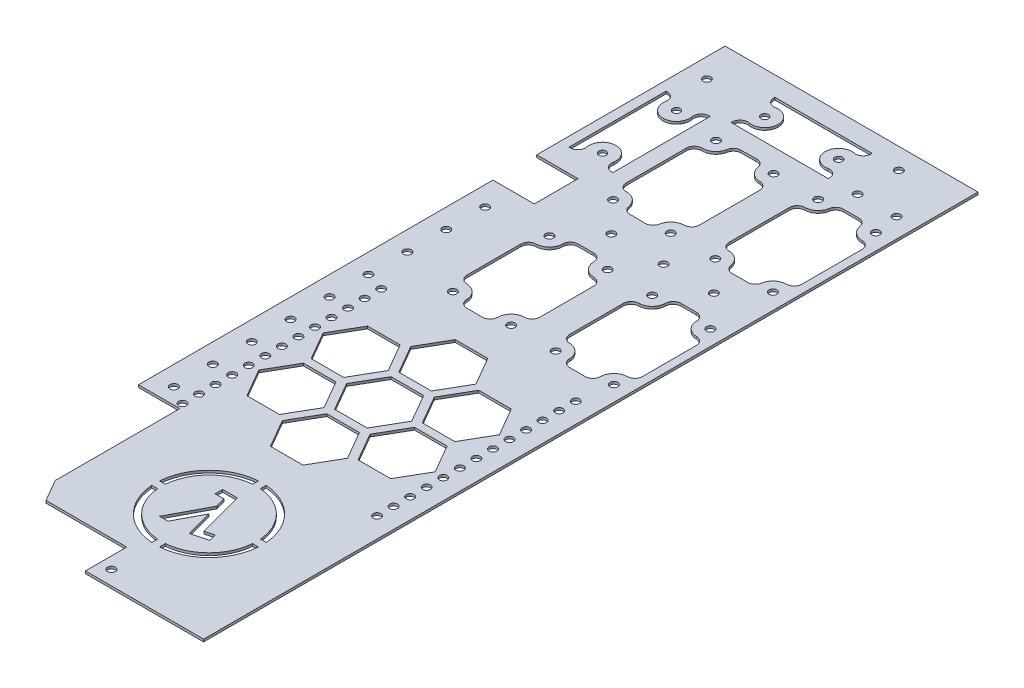
from build123d import *

# Parameters (mm, degrees)
SKETCH1_R           = 2.54
SKETCH1_R_2         = 2.413
BOSS_EXTRUDE1_DEPTH = 1.5875
SKETCH5_R           = 2.54
CUT_EXTRUDE1_DEPTH  = 548.721601199
SKETCH6_W           = 26.9875
SKETCH6_H           = 7.62
SKETCH6_W_2         = 10.16
SKETCH6_H_2         = 26.9875
CUT_EXTRUDE2_DEPTH  = 2.54


with BuildPart() as part:
    # Sketch1 → Boss-Extrude1 (new body)
    with BuildSketch(Plane(origin=(0, 0, 0), x_dir=(1, 0, 0), z_dir=(0, 1, 0))):
        Polygon((-347.6625, -284.566318976), (-347.6625, -358.297540145), (-339.43124039, -372.5545), (-296.8625, -372.5545), (-296.8625, -399.542), (-209.55, -399.542), (-209.55, 106.045), (-374.65, 106.045), (-374.65, -16.9545), (-347.6625, -16.9545), (-347.6625, -45.5295), (-374.65, -45.5295), (-374.65, -284.566318976), align=None)
        with Locations(Location((-349.635439689, -273.224316882, 0), (0, 0, 270))):
            Circle(SKETCH1_R, mode=Mode.SUBTRACT)
        with BuildLine():
            ThreePointArc((-281.14625, -361.805423394), (-303.301954333, -351.668613821), (-313.438763906, -329.512909488))
            Line((-313.438763906, -329.512909488), (-309.617403236, -329.512909488))
            ThreePointArc((-309.617403236, -329.512909488), (-300.607877497, -348.974536984), (-281.14625, -357.984062723))
            Line((-281.14625, -357.984062723), (-281.14625, -361.805423394))
        make_face(mode=Mode.SUBTRACT)
        with BuildLine():
            ThreePointArc((-313.438763906, -324.432909488), (-303.301954333, -302.277205155), (-281.14625, -292.140395582))
            Line((-281.14625, -292.140395582), (-281.14625, -295.961756252))
            ThreePointArc((-281.14625, -295.961756252), (-300.607877497, -304.971281991), (-309.617403236, -324.432909488))
            Line((-309.617403236, -324.432909488), (-313.438763906, -324.432909488))
        make_face(mode=Mode.SUBTRACT)
        with Locations(Location((-349.635439689, -262.414650564, 0), (0, 0, 270))):
            Circle(SKETCH1_R, mode=Mode.SUBTRACT)
        with Locations(Location((-349.635439689, -251.604984246, 0), (0, 0, 270))):
            Circle(SKETCH1_R, mode=Mode.SUBTRACT)
        with Locations(Location((-349.635439689, -240.795317929, 0), (0, 0, 270))):
            Circle(SKETCH1_R, mode=Mode.SUBTRACT)
        with Locations(Location((-349.635439689, -229.985651611, 0), (0, 0, 270))):
            Circle(SKETCH1_R, mode=Mode.SUBTRACT)
        with Locations(Location((-349.635439689, -219.175985293, 0), (0, 0, 270))):
            Circle(SKETCH1_R, mode=Mode.SUBTRACT)
        with Locations(Location((-349.635439689, -208.366318976, 0), (0, 0, 270))):
            Circle(SKETCH1_R, mode=Mode.SUBTRACT)
        with Locations(Location((-349.635439689, -197.556652658, 0), (0, 0, 270))):
            Circle(SKETCH1_R, mode=Mode.SUBTRACT)
        with Locations(Location((-349.635439689, -186.74698634, 0), (0, 0, 270))):
            Circle(SKETCH1_R, mode=Mode.SUBTRACT)
        with Locations(Location((-349.635439689, -175.937320022, 0), (0, 0, 270))):
            Circle(SKETCH1_R, mode=Mode.SUBTRACT)
        with Locations(Location((-349.635439689, -165.127653705, 0), (0, 0, 270))):
            Circle(SKETCH1_R, mode=Mode.SUBTRACT)
        with Locations(Location((-349.635439689, -154.317987387, 0), (0, 0, 270))):
            Circle(SKETCH1_R, mode=Mode.SUBTRACT)
        Polygon((-311.794219465, -210.906318976), (-301.162314258, -229.321318976), (-311.794219465, -247.736318976), (-333.05802988, -247.736318976), (-343.689935087, -229.321318976), (-333.05802988, -210.906318976), align=None, mode=Mode.SUBTRACT)
        Polygon((-311.794219465, -168.996318976), (-301.162314258, -187.411318976), (-311.794219465, -205.826318976), (-333.05802988, -205.826318976), (-343.689935087, -187.411318976), (-333.05802988, -168.996318976), align=None, mode=Mode.SUBTRACT)
        with BuildLine():
            ThreePointArc((-276.06625, -357.984062723), (-256.604622503, -348.974536984), (-247.595096764, -329.512909488))
            Line((-247.595096764, -329.512909488), (-243.773736094, -329.512909488))
            ThreePointArc((-243.773736094, -329.512909488), (-253.910545667, -351.668613821), (-276.06625, -361.805423394))
            Line((-276.06625, -361.805423394), (-276.06625, -357.984062723))
        make_face(mode=Mode.SUBTRACT)
        Polygon((-287.864467734, -344.458610625), (-293.399973917, -344.458610625), (-280.466285054, -320.031164161), (-282.197543544, -313.570019517), (-287.963258183, -313.570019517), (-287.963258183, -308.677931207), (-278.443712156, -308.677931207), (-270.461741683, -338.467050556), (-264.708186873, -336.925390192), (-263.442021248, -341.650784635), (-273.920970501, -344.458610625), (-278.60625, -326.972909488), align=None, mode=Mode.SUBTRACT)
        with BuildLine():
            Line((-276.06625, -295.961756252), (-276.06625, -292.140395582))
            ThreePointArc((-276.06625, -292.140395582), (-253.910545667, -302.277205155), (-243.773736094, -324.432909488))
            Line((-243.773736094, -324.432909488), (-247.595096764, -324.432909488))
            ThreePointArc((-247.595096764, -324.432909488), (-256.604622503, -304.971281991), (-276.06625, -295.961756252))
        make_face(mode=Mode.SUBTRACT)
        with Locations(Location((-222.626560311, -273.224316882, 0), (0, 0, 270))):
            Circle(SKETCH1_R, mode=Mode.SUBTRACT)
        Polygon((-275.499094793, -231.861318976), (-264.867189586, -250.276318976), (-275.499094793, -268.691318976), (-296.762905207, -268.691318976), (-307.394810414, -250.276318976), (-296.762905207, -231.861318976), align=None, mode=Mode.SUBTRACT)
        Polygon((-275.499094793, -189.951318976), (-264.867189586, -208.366318976), (-275.499094793, -226.781318976), (-296.762905207, -226.781318976), (-307.394810414, -208.366318976), (-296.762905207, -189.951318976), align=None, mode=Mode.SUBTRACT)
        Polygon((-275.499094793, -148.041318976), (-264.867189586, -166.456318976), (-275.499094793, -184.871318976), (-296.762905207, -184.871318976), (-307.394810414, -166.456318976), (-296.762905207, -148.041318976), align=None, mode=Mode.SUBTRACT)
        Polygon((-239.20397012, -210.906318976), (-228.572064913, -229.321318976), (-239.20397012, -247.736318976), (-260.467780535, -247.736318976), (-271.099685742, -229.321318976), (-260.467780535, -210.906318976), align=None, mode=Mode.SUBTRACT)
        with Locations(Location((-222.626560311, -262.414650564, 0), (0, 0, 270))):
            Circle(SKETCH1_R, mode=Mode.SUBTRACT)
        with Locations(Location((-222.626560311, -251.604984246, 0), (0, 0, 270))):
            Circle(SKETCH1_R, mode=Mode.SUBTRACT)
        with Locations(Location((-222.626560311, -240.795317929, 0), (0, 0, 270))):
            Circle(SKETCH1_R, mode=Mode.SUBTRACT)
        with Locations(Location((-222.626560311, -229.985651611, 0), (0, 0, 270))):
            Circle(SKETCH1_R, mode=Mode.SUBTRACT)
        with Locations(Location((-222.626560311, -219.175985293, 0), (0, 0, 270))):
            Circle(SKETCH1_R, mode=Mode.SUBTRACT)
        Polygon((-239.20397012, -168.996318976), (-228.572064913, -187.411318976), (-239.20397012, -205.826318976), (-260.467780535, -205.826318976), (-271.099685742, -187.411318976), (-260.467780535, -168.996318976), align=None, mode=Mode.SUBTRACT)
        with Locations(Location((-222.626560311, -208.366318976, 0), (0, 0, 270))):
            Circle(SKETCH1_R, mode=Mode.SUBTRACT)
        with Locations(Location((-222.626560311, -197.556652658, 0), (0, 0, 270))):
            Circle(SKETCH1_R, mode=Mode.SUBTRACT)
        with Locations(Location((-222.626560311, -186.74698634, 0), (0, 0, 270))):
            Circle(SKETCH1_R, mode=Mode.SUBTRACT)
        with Locations(Location((-222.626560311, -175.937320022, 0), (0, 0, 270))):
            Circle(SKETCH1_R, mode=Mode.SUBTRACT)
        with Locations(Location((-222.626560311, -165.127653705, 0), (0, 0, 270))):
            Circle(SKETCH1_R, mode=Mode.SUBTRACT)
        with Locations(Location((-222.626560311, -154.317987387, 0), (0, 0, 270))):
            Circle(SKETCH1_R, mode=Mode.SUBTRACT)
        with Locations(Location((-349.635439689, -143.508321069, 0), (0, 0, 270))):
            Circle(SKETCH1_R, mode=Mode.SUBTRACT)
        with Locations(Location((-324.6628, -121.666, 0), (0, 0, 270))):
            Circle(SKETCH1_R, mode=Mode.SUBTRACT)
        with BuildLine():
            Line((-329.438, -107.699325487), (-329.438, -72.640674513))
            ThreePointArc((-329.438, -72.640674513), (-327.989077576, -69.087974746), (-324.468836364, -67.561883781))
            ThreePointArc((-324.468836364, -67.561883781), (-318.365199406, -64.948737187), (-315.774269543, -58.835636364))
            ThreePointArc((-315.774269543, -58.835636364), (-314.254406454, -55.303389174), (-310.695109282, -53.848))
            Line((-310.695109282, -53.848), (-300.606690718, -53.848))
            ThreePointArc((-300.606690718, -53.848), (-297.047393546, -55.303389174), (-295.527530457, -58.835636364))
            ThreePointArc((-295.527530457, -58.835636364), (-292.925179285, -64.960179285), (-286.800636364, -67.562530457))
            ThreePointArc((-286.800636364, -67.562530457), (-283.268389174, -69.082393546), (-281.813, -72.641690718))
            Line((-281.813, -72.641690718), (-281.813, -107.698309282))
            ThreePointArc((-281.813, -107.698309282), (-283.268389174, -111.257606454), (-286.800636364, -112.777469543))
            ThreePointArc((-286.800636364, -112.777469543), (-292.925179285, -115.379820715), (-295.527530457, -121.504363636))
            ThreePointArc((-295.527530457, -121.504363636), (-297.047393546, -125.036610826), (-300.606690718, -126.492))
            Line((-300.606690718, -126.492), (-310.695109282, -126.492))
            ThreePointArc((-310.695109282, -126.492), (-314.254406454, -125.036610826), (-315.774269543, -121.504363636))
            ThreePointArc((-315.774269543, -121.504363636), (-318.365199406, -115.391262813), (-324.468836364, -112.778116219))
            ThreePointArc((-324.468836364, -112.778116219), (-327.989077576, -111.252025254), (-329.438, -107.699325487))
        make_face(mode=Mode.SUBTRACT)
        with Locations(Location((-324.6628, -58.674, 0), (0, 0, 270))):
            Circle(SKETCH1_R, mode=Mode.SUBTRACT)
        with Locations(Location((-354.094472403, 5.468735685, 0), (0, 0, 270))):
            Circle(SKETCH1_R_2, mode=Mode.SUBTRACT)
        with BuildLine():
            Line((-368.445472403, -2.151264315), (-368.445472403, 61.348735685))
            Line((-368.445472403, 61.348735685), (-367.702449806, 61.348735685))
            ThreePointArc((-367.702449806, 61.348735685), (-363.794667873, 59.514600804), (-362.708696631, 55.336625593))
            ThreePointArc((-362.708696631, 55.336625593), (-354.094472403, 44.965735685), (-345.480248176, 55.336625593))
            ThreePointArc((-345.480248176, 55.336625593), (-344.394276933, 59.514600804), (-340.486495, 61.348735685))
            Line((-340.486495, 61.348735685), (-339.743472403, 61.348735685))
            Line((-339.743472403, 61.348735685), (-339.743472403, -2.151264315))
            Line((-339.743472403, -2.151264315), (-340.486495, -2.151264315))
            ThreePointArc((-340.486495, -2.151264315), (-344.394276933, -0.317129433), (-345.480248176, 3.860845777))
            ThreePointArc((-345.480248176, 3.860845777), (-354.094472403, 14.231735685), (-362.708696631, 3.860845777))
            ThreePointArc((-362.708696631, 3.860845777), (-363.794667873, -0.317129433), (-367.702449806, -2.151264315))
            Line((-367.702449806, -2.151264315), (-368.445472403, -2.151264315))
        make_face(mode=Mode.SUBTRACT)
        with Locations(Location((-354.094472403, 53.728735685, 0), (0, 0, 270))):
            Circle(SKETCH1_R_2, mode=Mode.SUBTRACT)
        with Locations(Location((-324.268332048, -17.482469361, 0), (0, 0, 270))):
            Circle(SKETCH1_R, mode=Mode.SUBTRACT)
        with BuildLine():
            Line((-329.597773423, -3.514696489), (-329.597773423, 35.739252902))
            ThreePointArc((-329.597773423, 35.739252902), (-328.077662027, 39.363282858), (-324.427067468, 40.818443037))
            ThreePointArc((-324.427067468, 40.818443037), (-318.613536919, 42.847332482), (-315.512742635, 48.166975762))
            ThreePointArc((-315.512742635, 48.166975762), (-313.800929668, 51.156470569), (-310.575535645, 52.366518596))
            Line((-310.575535645, 52.366518596), (-300.486181661, 52.497585912))
            ThreePointArc((-300.486181661, 52.497585912), (-297.160774099, 51.314497189), (-295.408851173, 48.250382237))
            ThreePointArc((-295.408851173, 48.250382237), (-292.448569967, 42.977910171), (-286.800636364, 40.818495317))
            ThreePointArc((-286.800636364, 40.818495317), (-283.268389174, 39.298632228), (-281.813, 35.739335056))
            Line((-281.813, 35.739335056), (-281.813, -3.514778642))
            ThreePointArc((-281.813, -3.514778642), (-283.268389174, -7.074075815), (-286.800636364, -8.593938904))
            ThreePointArc((-286.800636364, -8.593938904), (-292.448569967, -10.753353758), (-295.408851173, -16.025825823))
            ThreePointArc((-295.408851173, -16.025825823), (-297.160774099, -19.089940776), (-300.486181661, -20.273029499))
            Line((-300.486181661, -20.273029499), (-310.575535645, -20.141962182))
            ThreePointArc((-310.575535645, -20.141962182), (-313.800929668, -18.931914156), (-315.512742635, -15.942419349))
            ThreePointArc((-315.512742635, -15.942419349), (-318.613536919, -10.622776069), (-324.427067468, -8.593886624))
            ThreePointArc((-324.427067468, -8.593886624), (-328.077662027, -7.138726445), (-329.597773423, -3.514696489))
        make_face(mode=Mode.SUBTRACT)
        with Locations(Location((-324.268332048, 49.707025774, 0), (0, 0, 270))):
            Circle(SKETCH1_R, mode=Mode.SUBTRACT)
        with Locations(Location((-321.818, 79.0575, 0), (0, 0, 270))):
            Circle(SKETCH1_R_2, mode=Mode.SUBTRACT)
        with BuildLine():
            Line((-329.438, 64.77), (-329.438, 65.449522597))
            ThreePointArc((-329.438, 65.449522597), (-327.603865118, 69.35730453), (-323.425889908, 70.443275772))
            ThreePointArc((-323.425889908, 70.443275772), (-313.055, 79.0575), (-323.425889908, 87.671724228))
            ThreePointArc((-323.425889908, 87.671724228), (-327.603865118, 88.75769547), (-329.438, 92.665477403))
            Line((-329.438, 92.665477403), (-329.438, 93.345))
            Line((-329.438, 93.345), (-265.938, 93.345))
            Line((-265.938, 93.345), (-265.938, 92.665477403))
            ThreePointArc((-265.938, 92.665477403), (-267.772134882, 88.75769547), (-271.950110092, 87.671724228))
            ThreePointArc((-271.950110092, 87.671724228), (-282.321, 79.0575), (-271.950110092, 70.443275772))
            ThreePointArc((-271.950110092, 70.443275772), (-267.772134882, 69.35730453), (-265.938, 65.449522597))
            Line((-265.938, 65.449522597), (-265.938, 64.77))
            Line((-265.938, 64.77), (-329.438, 64.77))
        make_face(mode=Mode.SUBTRACT)
        with Locations(Location((-286.639, -121.666, 0), (0, 0, 270))):
            Circle(SKETCH1_R, mode=Mode.SUBTRACT)
        with Locations(Location((-257.556, -121.666, 0), (0, 0, 270))):
            Circle(SKETCH1_R, mode=Mode.SUBTRACT)
        with Locations(Location((-286.639, -58.674, 0), (0, 0, 270))):
            Circle(SKETCH1_R, mode=Mode.SUBTRACT)
        with Locations(Location((-257.556, -58.674, 0), (0, 0, 270))):
            Circle(SKETCH1_R, mode=Mode.SUBTRACT)
        with BuildLine():
            Line((-262.382, -107.698309282), (-262.382, -72.641690718))
            ThreePointArc((-262.382, -72.641690718), (-260.926610826, -69.082393546), (-257.394363636, -67.562530457))
            ThreePointArc((-257.394363636, -67.562530457), (-251.269820715, -64.960179285), (-248.667469543, -58.835636364))
            ThreePointArc((-248.667469543, -58.835636364), (-247.147606454, -55.303389174), (-243.588309282, -53.848))
            Line((-243.588309282, -53.848), (-233.499890718, -53.848))
            ThreePointArc((-233.499890718, -53.848), (-229.940593546, -55.303389174), (-228.420730457, -58.835636364))
            ThreePointArc((-228.420730457, -58.835636364), (-225.829800594, -64.948737187), (-219.726163636, -67.561883781))
            ThreePointArc((-219.726163636, -67.561883781), (-216.205922424, -69.087974746), (-214.757, -72.640674513))
            Line((-214.757, -72.640674513), (-214.757, -107.699325487))
            ThreePointArc((-214.757, -107.699325487), (-216.205922424, -111.252025254), (-219.726163636, -112.778116219))
            ThreePointArc((-219.726163636, -112.778116219), (-225.829800594, -115.391262813), (-228.420730457, -121.504363636))
            ThreePointArc((-228.420730457, -121.504363636), (-229.940593546, -125.036610826), (-233.499890718, -126.492))
            Line((-233.499890718, -126.492), (-243.588309282, -126.492))
            ThreePointArc((-243.588309282, -126.492), (-247.147606454, -125.036610826), (-248.667469543, -121.504363636))
            ThreePointArc((-248.667469543, -121.504363636), (-251.269820715, -115.379820715), (-257.394363636, -112.777469543))
            ThreePointArc((-257.394363636, -112.777469543), (-260.926610826, -111.257606454), (-262.382, -107.698309282))
        make_face(mode=Mode.SUBTRACT)
        with Locations(Location((-222.626560311, -143.508321069, 0), (0, 0, 270))):
            Circle(SKETCH1_R, mode=Mode.SUBTRACT)
        with Locations(Location((-219.5322, -121.666, 0), (0, 0, 270))):
            Circle(SKETCH1_R, mode=Mode.SUBTRACT)
        with Locations(Location((-219.5322, -58.674, 0), (0, 0, 270))):
            Circle(SKETCH1_R, mode=Mode.SUBTRACT)
        with Locations(Location((-286.639, -17.482469361, 0), (0, 0, 270))):
            Circle(SKETCH1_R, mode=Mode.SUBTRACT)
        with Locations(Location((-257.556, -17.482469361, 0), (0, 0, 270))):
            Circle(SKETCH1_R, mode=Mode.SUBTRACT)
        with Locations(Location((-286.639, 49.707025774, 0), (0, 0, 270))):
            Circle(SKETCH1_R, mode=Mode.SUBTRACT)
        with Locations(Location((-273.558, 79.0575, 0), (0, 0, 270))):
            Circle(SKETCH1_R_2, mode=Mode.SUBTRACT)
        with Locations(Location((-257.556, 49.707025774, 0), (0, 0, 270))):
            Circle(SKETCH1_R, mode=Mode.SUBTRACT)
        with BuildLine():
            Line((-262.382, -3.514778642), (-262.382, 35.739335056))
            ThreePointArc((-262.382, 35.739335056), (-260.926610826, 39.298632228), (-257.394363636, 40.818495317))
            ThreePointArc((-257.394363636, 40.818495317), (-251.762012258, 42.964488711), (-248.792982073, 48.209822777))
            ThreePointArc((-248.792982073, 48.209822777), (-247.061228956, 51.237097184), (-243.785543258, 52.434278207))
            Line((-243.785543258, 52.434278207), (-233.697124694, 52.434278207))
            ThreePointArc((-233.697124694, 52.434278207), (-230.421438996, 51.237097184), (-228.689685879, 48.209822777))
            ThreePointArc((-228.689685879, 48.209822777), (-225.681833155, 42.931321125), (-219.986189608, 40.817225035))
            ThreePointArc((-219.986189608, 40.817225035), (-216.416094405, 39.317395961), (-214.940201982, 35.737338899))
            Line((-214.940201982, 35.737338899), (-214.940201982, -3.512782486))
            ThreePointArc((-214.940201982, -3.512782486), (-216.416094405, -7.092839548), (-219.986189608, -8.592668622))
            ThreePointArc((-219.986189608, -8.592668622), (-225.681833155, -10.706764712), (-228.689685879, -15.985266363))
            ThreePointArc((-228.689685879, -15.985266363), (-230.421438996, -19.01254077), (-233.697124694, -20.209721793))
            Line((-233.697124694, -20.209721793), (-243.785543258, -20.209721793))
            ThreePointArc((-243.785543258, -20.209721793), (-247.061228956, -19.01254077), (-248.792982073, -15.985266363))
            ThreePointArc((-248.792982073, -15.985266363), (-251.762012258, -10.739932298), (-257.394363636, -8.593938904))
            ThreePointArc((-257.394363636, -8.593938904), (-260.926610826, -7.074075815), (-262.382, -3.514778642))
        make_face(mode=Mode.SUBTRACT)
        with Locations(Location((-219.926667952, -17.482469361, 0), (0, 0, 270))):
            Circle(SKETCH1_R, mode=Mode.SUBTRACT)
        with Locations(Location((-219.926667952, 49.707025774, 0), (0, 0, 270))):
            Circle(SKETCH1_R, mode=Mode.SUBTRACT)
    extrude(amount=BOSS_EXTRUDE1_DEPTH)

    # Sketch5 → Cut-Extrude1 (cut, through all)
    with BuildSketch(Plane(origin=(0, 1.5875, 0), x_dir=(1, 0, 0), z_dir=(0, 1, 0))):
        with Locations(Location((-247.65, 65.5574, 0), (0, 0, 270))):
            Circle(SKETCH5_R)
        with Locations(Location((-222.25, 65.5574, 0), (0, 0, 270))):
            Circle(SKETCH5_R)
        with Locations(Location((-247.65, 92.456, 0), (0, 0, 270))):
            Circle(SKETCH5_R)
        with Locations(Location((-361.95, 81.4451, 0), (0, 0, 270))):
            Circle(SKETCH5_R)
        with Locations(Location((-305.591986417, -37.338, 0), (0, 0, 270))):
            Circle(SKETCH5_R)
        with Locations(Location((-271.419688906, -37.338, 0), (0, 0, 270))):
            Circle(SKETCH5_R)
        with Locations(Location((-238.640904388, -37.338, 0), (0, 0, 270))):
            Circle(SKETCH5_R)
        with Locations(Location((-279.0825, -390.144, 0), (0, 0, 270))):
            Circle(SKETCH5_R)
        with Locations(Location((-361.95, -63.3095, 0), (0, 0, 270))):
            Circle(SKETCH5_R)
        with Locations(Location((-361.95, -88.7095, 0), (0, 0, 270))):
            Circle(SKETCH5_R)
        with Locations(Location((-361.95, -114.1095, 0), (0, 0, 270))):
            Circle(SKETCH5_R)
        with Locations(Location((-361.95, -139.5095, 0), (0, 0, 270))):
            Circle(SKETCH5_R)
        with Locations(Location((-361.95, -164.9095, 0), (0, 0, 270))):
            Circle(SKETCH5_R)
        with Locations(Location((-361.95, -190.3095, 0), (0, 0, 270))):
            Circle(SKETCH5_R)
        with Locations(Location((-361.95, -215.7095, 0), (0, 0, 270))):
            Circle(SKETCH5_R)
        with Locations(Location((-361.95, -241.1095, 0), (0, 0, 270))):
            Circle(SKETCH5_R)
        with Locations(Location((-361.95, -266.5095, 0), (0, 0, 270))):
            Circle(SKETCH5_R)
    extrude(amount=-CUT_EXTRUDE1_DEPTH, mode=Mode.SUBTRACT)

    # Sketch6 → Cut-Extrude2 (cut)
    with BuildSketch(Plane(origin=(0, 1.5875, 0), x_dir=(1, 0, 0), z_dir=(0, 1, 0))):
        with Locations((-361.15625, -280.756318976)):
            Rectangle(SKETCH6_W, SKETCH6_H)
        with Locations((-291.7825, -386.04825)):
            Rectangle(SKETCH6_W_2, SKETCH6_H_2)
    extrude(amount=-CUT_EXTRUDE2_DEPTH, mode=Mode.SUBTRACT)


solid = part.part
